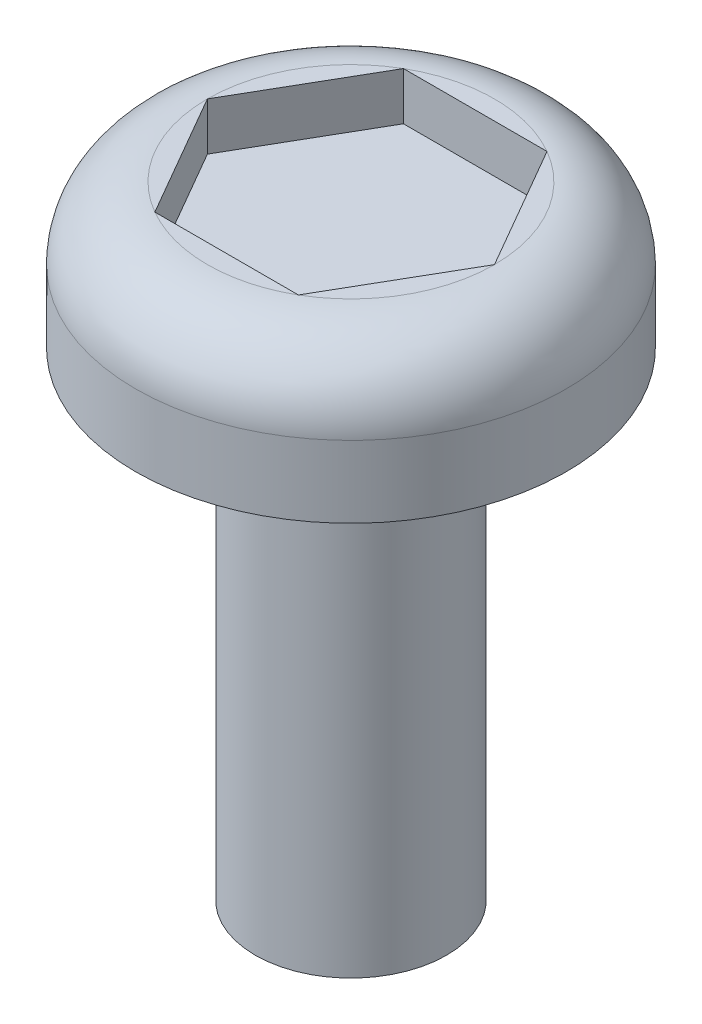
from build123d import *

# Parameters (mm, degrees)
SKETCH1_R           = 1
BOSS_EXTRUDE1_DEPTH = 5
SKETCH2_R           = 2.25
BOSS_EXTRUDE2_DEPTH = 1.5
FILLET1_R           = 0.75
CUT_EXTRUDE1_DEPTH  = 0.5


with BuildPart() as part:
    # Sketch1 → Boss-Extrude1 (new body)
    with BuildSketch(Plane(origin=(0, 0, 0), x_dir=(1, 0, 0), z_dir=(0, 1, 0))):
        Circle(SKETCH1_R)
    extrude(amount=BOSS_EXTRUDE1_DEPTH)

    # Sketch2 → Boss-Extrude2 (add)
    with BuildSketch(Plane(origin=(0, 5, 0), x_dir=(1, 0, 0), z_dir=(0, 1, 0))):
        Circle(SKETCH2_R)
    extrude(amount=BOSS_EXTRUDE2_DEPTH)

    # Fillet1
    fillet1_edges = [part.edges().sort_by_distance(p)[0] for p in [
        (-2.25, 6.5, 0),
    ]]
    fillet(fillet1_edges, radius=FILLET1_R)

    # Sketch3 → Cut-Extrude1 (cut)
    with BuildSketch(Plane(origin=(0, 6.5, 0), x_dir=(1, 0, 0), z_dir=(0, 1, 0))):
        Polygon((1.5, 0), (0.75, 1.299038106), (-0.75, 1.299038106), (-1.5, 0), (-0.75, -1.299038106), (0.75, -1.299038106), align=None)
    extrude(amount=-CUT_EXTRUDE1_DEPTH, mode=Mode.SUBTRACT)


solid = part.part
